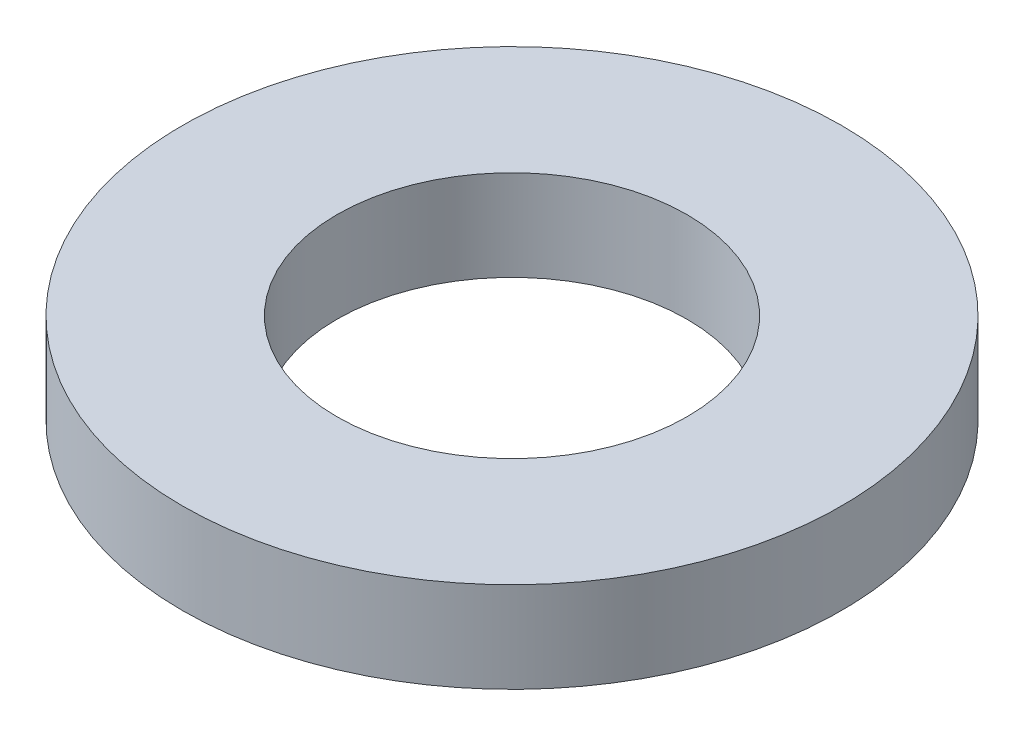
from build123d import *

# Parameters (mm, degrees)
SKETCH1_R           = 80
BOSS_EXTRUDE1_DEPTH = 22
SKETCH2_R           = 42.5
CUT_EXTRUDE1_DEPTH  = 116.256236274


with BuildPart() as part:
    # Sketch1 → Boss-Extrude1 (new body)
    with BuildSketch(Plane(origin=(0, 0, 0), x_dir=(1, 0, 0), z_dir=(0, 1, 0))):
        Circle(SKETCH1_R)
    extrude(amount=BOSS_EXTRUDE1_DEPTH)

    # Sketch2 → Cut-Extrude1 (cut, through all)
    with BuildSketch(Plane(origin=(0, 0, 0), x_dir=(1, 0, 0), z_dir=(0, 1, 0))):
        Circle(SKETCH2_R)
    extrude(amount=CUT_EXTRUDE1_DEPTH, mode=Mode.SUBTRACT)


solid = part.part
